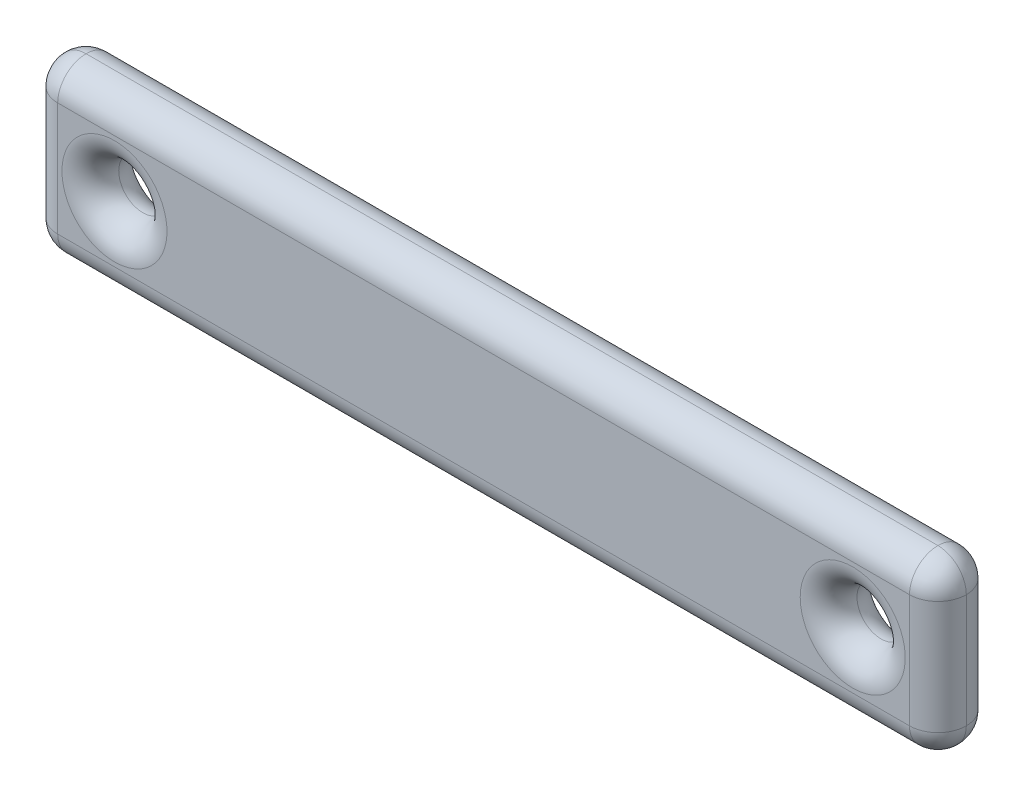
from build123d import *

# Parameters (mm, degrees)
SKETCH_1_W      = 64
SKETCH_1_H      = 12
SKETCH_1_R      = 1.7
EXTRUDE_1_DEPTH = 2
FILLET_1_R      = 2


with BuildPart() as part:
    # 草图1 → 凸台-拉伸1 (new, symmetric)
    with BuildSketch(Plane.XY):
        with Locations((26, 0)):
            Rectangle(SKETCH_1_W, SKETCH_1_H)
        Circle(SKETCH_1_R, mode=Mode.SUBTRACT)
        with Locations((52, 0)):
            Circle(SKETCH_1_R, mode=Mode.SUBTRACT)
    extrude(amount=EXTRUDE_1_DEPTH, both=True)

    # 圆角1
    fillet_1_edges = [part.edges().sort_by_distance(p)[0] for p in [
        (-1.7, 0, -2),
        (-1.7, 0, 2),
        (-6, 0, 2),
        (50.3, 0, -2),
        (50.3, 0, 2),
        (26, -6, 2),
        (58, 0, 2),
        (26, -6, -2),
        (-6, 0, -2),
        (26, 6, -2),
        (58, 0, -2),
        (58, -6, 0),
        (-6, -6, 0),
        (-6, 6, 0),
        (58, 6, 0),
        (26, 6, 2),
    ]]
    fillet(fillet_1_edges, radius=FILLET_1_R - 0.0001)  # a hair under: the kernel refuses the full size


solid = part.part
